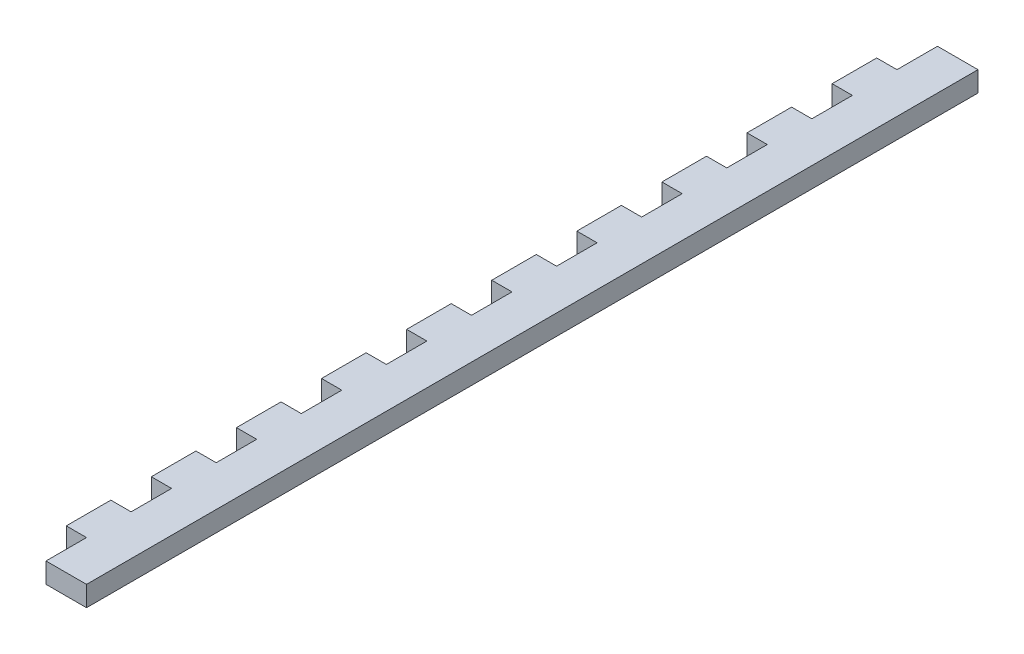
from build123d import *

# Parameters (mm, degrees)
SKETCH1_W           = 279.4
SKETCH1_H           = 285.75
BOSS_EXTRUDE1_DEPTH = 6.35
SKETCH2_W           = 279.4
SKETCH2_H           = 6.35
BOSS_EXTRUDE2_DEPTH = 12.7
CUT_EXTRUDE1_DEPTH  = 201.72931556
SKETCH5_W           = 64.924912319
SKETCH5_H           = 367.966813298
CUT_EXTRUDE2_DEPTH  = 315.389134871
SKETCH4_W           = 12.7
SKETCH4_H           = 6.35
CUT_EXTRUDE3_DEPTH  = 6.35


with BuildPart() as part:
    # Sketch1 → Boss-Extrude1 (new body)
    with BuildSketch(Plane(origin=(0, 0, 0), x_dir=(0, 0, -1), z_dir=(1, 0, 0))):
        Rectangle(SKETCH1_W, SKETCH1_H)
    extrude(amount=BOSS_EXTRUDE1_DEPTH)

    # Sketch2 → Boss-Extrude2 (add)
    with BuildSketch(Plane(origin=(6.35, 0, 0), x_dir=(0, 0, -1), z_dir=(1, 0, 0))):
        with Locations((0, 139.7)):
            Rectangle(SKETCH2_W, SKETCH2_H)
    extrude(amount=BOSS_EXTRUDE2_DEPTH)

    # Sketch3 → Cut-Extrude1 (cut, through all)
    with BuildSketch(Plane.ZY):
        with BuildLine():
            Line((-114.3, -85.725), (-25.4, -85.725))
            ThreePointArc((-25.4, -85.725), (-12.7, -98.425), (-25.4, -111.125))
            Line((-25.4, -111.125), (-114.3, -111.125))
            ThreePointArc((-114.3, -111.125), (-127, -98.425), (-114.3, -85.725))
        make_face()
    extrude(amount=-CUT_EXTRUDE1_DEPTH, mode=Mode.SUBTRACT)

    # Sketch5 → Cut-Extrude2 (cut, through all)
    with BuildSketch(Plane(origin=(0, 0, -139.7), x_dir=(-1, 0, 0), z_dir=(0, 0, -1))):
        with Locations((13.41245616, -47.458406649)):
            Rectangle(SKETCH5_W, SKETCH5_H)
    extrude(amount=-CUT_EXTRUDE2_DEPTH, mode=Mode.SUBTRACT)

    # Sketch4 → Cut-Extrude3 (cut)
    with BuildSketch(Plane.ZY):
        with Locations((-106.68, 139.7)):
            Rectangle(SKETCH4_W, SKETCH4_H)
        with Locations((-133.35, 139.7)):
            Rectangle(SKETCH4_W, SKETCH4_H)
        with Locations((-80.01, 139.7)):
            Rectangle(SKETCH4_W, SKETCH4_H)
        with Locations((-53.34, 139.7)):
            Rectangle(SKETCH4_W, SKETCH4_H)
        with Locations((-26.67, 139.7)):
            Rectangle(SKETCH4_W, SKETCH4_H)
        with Locations((0, 139.7)):
            Rectangle(SKETCH4_W, SKETCH4_H)
        with Locations((26.67, 139.7)):
            Rectangle(SKETCH4_W, SKETCH4_H)
        with Locations((53.34, 139.7)):
            Rectangle(SKETCH4_W, SKETCH4_H)
        with Locations((80.01, 139.7)):
            Rectangle(SKETCH4_W, SKETCH4_H)
        with Locations((106.68, 139.7)):
            Rectangle(SKETCH4_W, SKETCH4_H)
        with Locations((133.35, 139.7)):
            Rectangle(SKETCH4_W, SKETCH4_H)
    extrude(amount=-CUT_EXTRUDE3_DEPTH, mode=Mode.SUBTRACT)


solid = part.part
